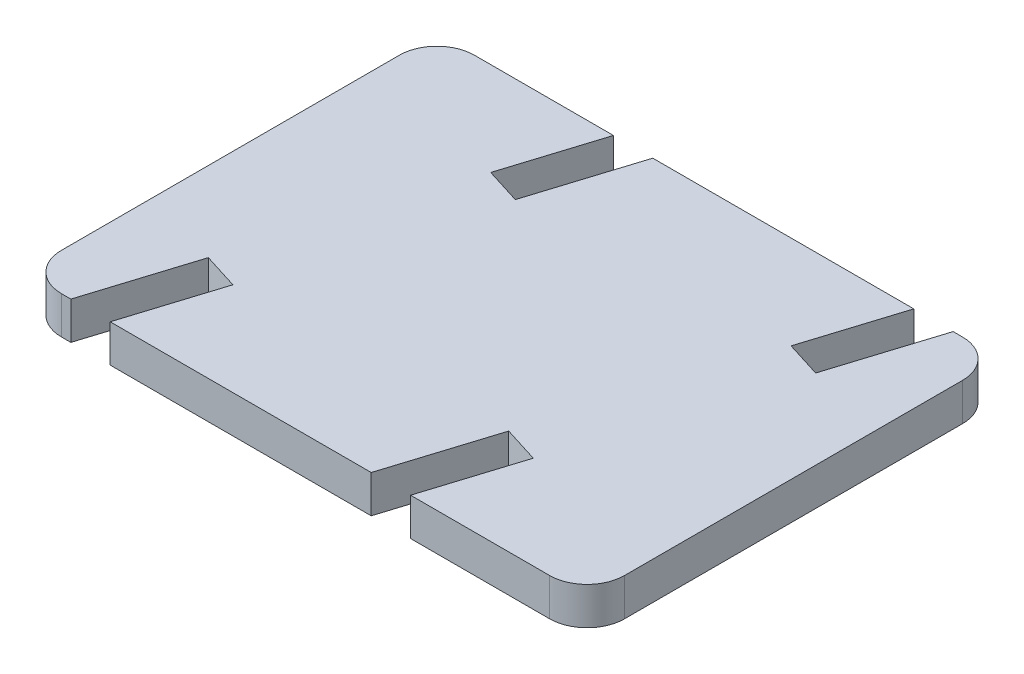
from build123d import *

# Parameters (mm, degrees)
BOSS_EXTRUDE1_DEPTH = 5


with BuildPart() as part:
    # Sketch1 → Boss-Extrude1 (new body)
    with BuildSketch(Plane(origin=(0, 0, 0), x_dir=(1, 0, 0), z_dir=(0, 1, 0))):
        with BuildLine():
            Line((23.507308231, 55), (19.604734899, 42.5605475))
            Line((19.604734899, 42.5605475), (24.375467337, 41.063847128))
            Line((24.375467337, 41.063847128), (28.747593727, 55))
            Line((28.747593727, 55), (63.507308231, 55))
            Line((63.507308231, 55), (59.604734899, 42.5605475))
            Line((59.604734899, 42.5605475), (64.375467337, 41.063847128))
            Line((64.375467337, 41.063847128), (68.747593727, 55))
            Line((68.747593727, 55), (70, 55))
            ThreePointArc((70, 55), (73.535533906, 53.535533906), (75, 50))
            Line((75, 50), (75, 5))
            ThreePointArc((75, 5), (73.535533906, 1.464466094), (70, 0))
            Line((70, 0), (51.492691769, 0))
            Line((51.492691769, 0), (55.395265101, 12.4394525))
            Line((55.395265101, 12.4394525), (50.624532663, 13.936152872))
            Line((50.624532663, 13.936152872), (46.252406273, 0))
            Line((46.252406273, 0), (11.492691769, 0))
            Line((11.492691769, 0), (15.395265101, 12.4394525))
            Line((15.395265101, 12.4394525), (10.624532663, 13.936152872))
            Line((10.624532663, 13.936152872), (6.252406273, 0))
            Line((6.252406273, 0), (5, 0))
            ThreePointArc((5, 0), (1.464466094, 1.464466094), (0, 5))
            Line((0, 5), (0, 50))
            ThreePointArc((0, 50), (1.464466094, 53.535533906), (5, 55))
            Line((5, 55), (23.507308231, 55))
        make_face()
    extrude(amount=BOSS_EXTRUDE1_DEPTH)


solid = part.part
